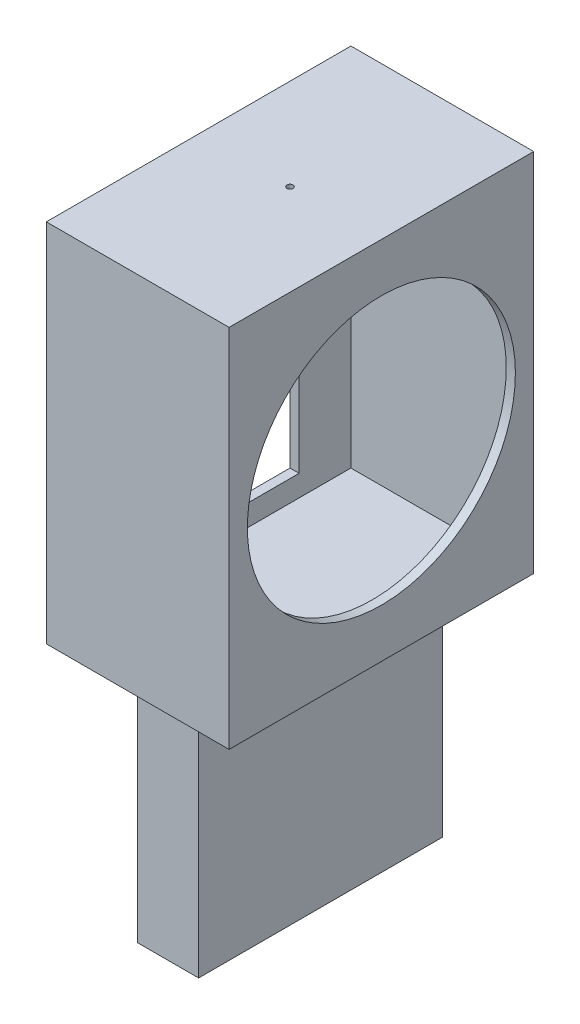
from build123d import *

# Parameters (mm, degrees)
OUTER_START        = 98
SKETCH1_W          = 100
SKETCH1_H          = 120
OUTER_DEPTH        = 60
INNER_START        = 101
SKETCH2_W          = 94
SKETCH2_H          = 114
INNER_DEPTH        = 54
THROAT_PORT_START  = 97
SKETCH3_W          = 60
SKETCH3_H          = 100
THROAT_PORT_DEPTH  = 5
FAN_PORT_START     = 154
SKETCH4_R          = 44
FAN_PORT_DEPTH     = 5
TC_PORT_START      = 196
SKETCH5_R          = 1
TC_PORT_DEPTH      = 5
PLENUM_STAND_START = 118
SKETCH6_W          = 80
SKETCH6_H          = 80
PLENUM_STAND_DEPTH = 20


with BuildPart() as part:
    # Sketch1 → outer (new body)
    with BuildSketch(Plane(origin=(0, 0, 0), x_dir=(0, 0, -1), z_dir=(1, 0, 0)).offset(OUTER_START)):
        with Locations((0, 140)):
            Rectangle(SKETCH1_W, SKETCH1_H)
    extrude(amount=OUTER_DEPTH)


with BuildPart() as body_2:
    # Sketch2 → inner (new body)
    with BuildSketch(Plane(origin=(0, 0, 0), x_dir=(0, 0, -1), z_dir=(1, 0, 0)).offset(INNER_START)):
        with Locations((0, 140)):
            Rectangle(SKETCH2_W, SKETCH2_H)
    extrude(amount=INNER_DEPTH)


with BuildPart() as body_3:
    # Sketch3 → throat_port (new body)
    with BuildSketch(Plane(origin=(0, 0, 0), x_dir=(0, 0, -1), z_dir=(1, 0, 0)).offset(THROAT_PORT_START)):
        with Locations((0, 140)):
            Rectangle(SKETCH3_W, SKETCH3_H)
    extrude(amount=THROAT_PORT_DEPTH)


with BuildPart() as body_4:
    # Sketch4 → fan_port (new body)
    with BuildSketch(Plane(origin=(0, 0, 0), x_dir=(0, 0, -1), z_dir=(1, 0, 0)).offset(FAN_PORT_START)):
        with Locations((0, 140)):
            Circle(SKETCH4_R)
    extrude(amount=FAN_PORT_DEPTH)


with BuildPart() as body_5:
    # Sketch5 → tc_port (new body)
    with BuildSketch(Plane(origin=(0, 0, 0), x_dir=(1, 0, 0), z_dir=(0, 1, 0)).offset(TC_PORT_START)):
        with Locations((128, 0)):
            Circle(SKETCH5_R)
    extrude(amount=TC_PORT_DEPTH)


with BuildPart() as part_1:
    add(part.part)

    # Combine1: cut body 2, body 3, body 4, body 5
    add(body_2.part, mode=Mode.SUBTRACT)
    add(body_3.part, mode=Mode.SUBTRACT)
    add(body_4.part, mode=Mode.SUBTRACT)
    add(body_5.part, mode=Mode.SUBTRACT)


with BuildPart() as body_2_2:
    # Sketch6 → plenum_stand (new body)
    with BuildSketch(Plane(origin=(0, 0, 0), x_dir=(0, 0, -1), z_dir=(1, 0, 0)).offset(PLENUM_STAND_START)):
        with Locations((0, 40)):
            Rectangle(SKETCH6_W, SKETCH6_H)
    extrude(amount=PLENUM_STAND_DEPTH)


solid = Compound([part_1.part, body_2_2.part])
